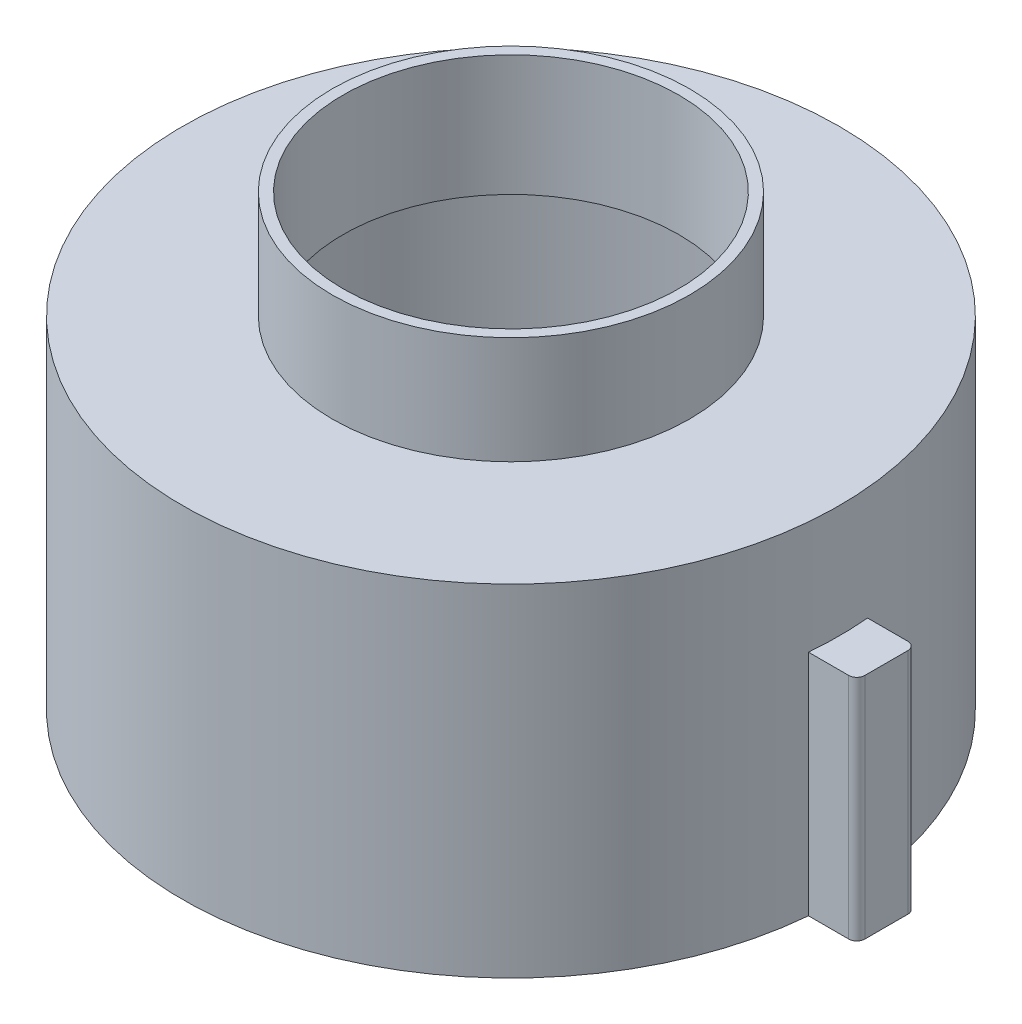
from build123d import *

# Parameters (mm, degrees)
CUT_EXTRUDE1_DEPTH      = 237.926412626
CUT_EXTRUDE1_DEPTH_BACK = 237.926412626
BOSS_EXTRUDE2_START     = -5
BOSS_EXTRUDE2_DEPTH     = 85
BOSS_EXTRUDE3_START     = -3
BOSS_EXTRUDE3_DEPTH     = 3
FILLET1_R               = 1.5
FILLET2_R               = 3
FILLET1_OF_MIRROR1_R    = 1.5
FILLET2_OF_MIRROR1_R    = 3


with BuildPart() as part:
    # Sketch1 → Revolve1 (revolve)
    with BuildSketch(Plane.XY):
        Polygon((-122.25, -5), (-118.25, -5), (-118.25, 2), (-115.25, 2), (-115.25, 117), (-62.5, 117), (-62.5, 162), (-66.5, 162), (-66.5, 122), (-115.25, 122), (-122.25, 122), align=None)
    revolve(axis=Axis((0, 0, 0), (0, 1, 0)))

    # Sketch3 → Cut-Extrude1 (cut, two sides: drawn at the far end of the back side and taken through both)
    with BuildSketch(Plane(origin=(0, 0, 0), x_dir=(0, 0, -1), z_dir=(1, 0, 0)).offset(-CUT_EXTRUDE1_DEPTH_BACK)):
        with BuildLine():
            Line((-9.5, -5), (-9.5, 65))
            ThreePointArc((-9.5, 65), (0, 74.5), (9.5, 65))
            Line((9.5, 65), (9.5, -5))
            ThreePointArc((9.5, -5), (0, -14.5), (-9.5, -5))
        make_face()
    extrude(amount=CUT_EXTRUDE1_DEPTH + CUT_EXTRUDE1_DEPTH_BACK, mode=Mode.SUBTRACT)

    # Sketch2 → Boss-Extrude2 (add)
    with BuildSketch(Plane(origin=(0, 0, 0), x_dir=(1, 0, 0), z_dir=(0, 1, 0)).offset(BOSS_EXTRUDE2_START)):
        Polygon((139.737260457, 11), (117.737260457, 11), (117.737260457, 9.5), (138.237260457, 9.5), (138.237260457, -9.5), (117.737260457, -9.5), (117.737260457, -11), (139.737260457, -11), align=None)
    boss_extrude2 = extrude(amount=BOSS_EXTRUDE2_DEPTH)

    # Sketch5 → Boss-Extrude3 (add)
    with BuildSketch(Plane(origin=(0, 80, 0), x_dir=(1, 0, 0), z_dir=(0, 1, 0)).offset(BOSS_EXTRUDE3_START)):
        with BuildLine():
            Line((138.237260457, -9.5), (138.237260457, 9.5))
            Line((138.237260457, 9.5), (121.880320397, 9.5))
            ThreePointArc((121.880320397, 9.5), (122.157545138, 4.753595035), (122.25, 0))
            ThreePointArc((122.25, 0), (122.157545138, -4.753595035), (121.880320397, -9.5))
            Line((121.880320397, -9.5), (138.237260457, -9.5))
        make_face()
    boss_extrude3 = extrude(amount=BOSS_EXTRUDE3_DEPTH)

    # Fillet1
    fillet1_edges = [part.edges().sort_by_distance(p)[0] for p in [
        (138.237260457, 36, -9.5),
        (138.237260457, 36, 9.5),
    ]]
    fillet(fillet1_edges, radius=FILLET1_R)

    # Fillet2
    fillet2_edges = [part.edges().sort_by_distance(p)[0] for p in [
        (139.737260457, 37.5, -11),
        (139.737260457, 37.5, 11),
    ]]
    fillet(fillet2_edges, radius=FILLET2_R)

    # Mirror1: Boss-Extrude2, Boss-Extrude3 across plane
    add(boss_extrude2.mirror(Plane(origin=(0, 0, 0), x_dir=(0, 0, 1), z_dir=(1, 0, 0))))
    add(boss_extrude3.mirror(Plane(origin=(0, 0, 0), x_dir=(0, 0, 1), z_dir=(1, 0, 0))))

    # Fillet1 of Mirror1
    fillet1_of_mirror1_edges = [part.edges().sort_by_distance(p)[0] for p in [
        (-138.237260457, 36, -9.5),
        (-138.237260457, 36, 9.5),
    ]]
    fillet(fillet1_of_mirror1_edges, radius=FILLET1_OF_MIRROR1_R)

    # Fillet2 of Mirror1
    fillet2_of_mirror1_edges = [part.edges().sort_by_distance(p)[0] for p in [
        (-139.737260457, 37.5, -11),
        (-139.737260457, 37.5, 11),
    ]]
    fillet(fillet2_of_mirror1_edges, radius=FILLET2_OF_MIRROR1_R)


solid = part.part
